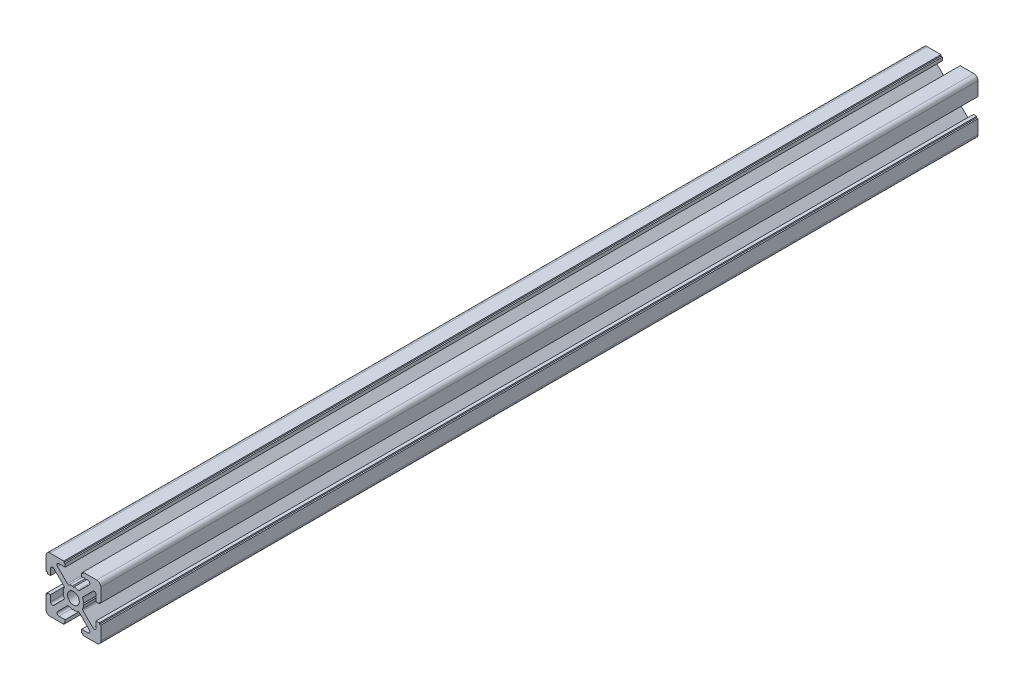
from build123d import *

# Parameters (mm, degrees)
SKETCH1_R           = 2.15
BOSS_EXTRUDE1_DEPTH = 320


# Read off the part's stored shape, not the designer's step: moBlkMgr[nhom 20x20x300]
with BuildPart() as part:
    # Sketch1 → Boss-Extrude1 (new body)
    with BuildSketch(Plane.XY.offset(330)):
        with BuildLine():
            Line((-3.499999948, -10), (-3.499999948, -9.5))
            Line((-3.499999948, -9.5), (-2.999999948, -9.5))
            Line((-2.999999948, -9.5), (-2.999999948, -8.299999966))
            Line((-2.999999948, -8.299999966), (-5.299390249, -8.299999966))
            ThreePointArc((-5.299390249, -8.299999966), (-5.946105921, -7.86787837), (-5.794364998, -7.105025221))
            Line((-5.794364998, -7.105025221), (-2.175465548, -3.48612574))
            ThreePointArc((-2.175465548, -3.48612574), (-1.907085057, -3.346986956), (-1.607569547, -3.387952169))
            ThreePointArc((-1.607569547, -3.387952169), (-0.96970891, -3.622452814), (-0.299999981, -3.73798071))
            Line((-0.299999981, -3.73798071), (1.9e-08, -3.449999972))
            Line((1.9e-08, -3.449999972), (0.300000019, -3.737980711))
            ThreePointArc((0.300000019, -3.737980711), (0.969708957, -3.622452812), (1.607569601, -3.387952162))
            ThreePointArc((1.607569601, -3.387952162), (1.90708511, -3.346986948), (2.175465602, -3.48612573))
            Line((2.175465602, -3.48612573), (5.794365084, -7.105025212))
            ThreePointArc((5.794365084, -7.105025212), (5.946106011, -7.867878366), (5.299390334, -8.299999966))
            Line((5.299390334, -8.299999966), (2.999999948, -8.299999966))
            Line((2.999999948, -8.299999966), (2.999999948, -9.5))
            Line((2.999999948, -9.5), (3.499999948, -9.5))
            Line((3.499999948, -9.5), (3.499999948, -10))
            Line((3.499999948, -10), (8.499999948, -10))
            ThreePointArc((8.499999948, -10), (9.56066012, -9.560660172), (9.999999948, -8.5))
            Line((9.999999948, -8.5), (9.999999948, -3.5))
            Line((9.999999948, -3.5), (9.499999948, -3.5))
            Line((9.499999948, -3.5), (9.499999948, -3))
            Line((9.499999948, -3), (8.299999978, -3))
            Line((8.299999978, -3), (8.299999978, -5.299390319))
            ThreePointArc((8.299999978, -5.299390319), (7.867878379, -5.946105992), (7.105025229, -5.794365063))
            Line((7.105025229, -5.794365063), (3.486125768, -2.17546557))
            ThreePointArc((3.486125768, -2.17546557), (3.346986986, -1.907085078), (3.387952202, -1.607569568))
            ThreePointArc((3.387952202, -1.607569568), (3.622452857, -0.969708918), (3.737980757, -0.299999973))
            Line((3.737980757, -0.299999973), (3.450000019, 2.8e-08))
            Line((3.450000019, 2.8e-08), (3.737980758, 0.300000028))
            ThreePointArc((3.737980758, 0.300000028), (3.622452857, 0.969708973), (3.387952202, 1.607569624))
            ThreePointArc((3.387952202, 1.607569624), (3.346986986, 1.907085133), (3.486125768, 2.175465626))
            Line((3.486125768, 2.175465626), (7.105025231, 5.794365121))
            ThreePointArc((7.105025231, 5.794365121), (7.86787838, 5.94610605), (8.299999978, 5.299390377))
            Line((8.299999978, 5.299390377), (8.299999978, 3))
            Line((8.299999978, 3), (9.499999948, 3))
            Line((9.499999948, 3), (9.499999948, 3.5))
            Line((9.499999948, 3.5), (9.999999948, 3.5))
            Line((9.999999948, 3.5), (9.999999948, 8.5))
            ThreePointArc((9.999999948, 8.5), (9.56066012, 9.560660172), (8.499999948, 10))
            Line((8.499999948, 10), (3.499999948, 10))
            Line((3.499999948, 10), (3.499999948, 9.5))
            Line((3.499999948, 9.5), (2.999999948, 9.5))
            Line((2.999999948, 9.5), (2.999999948, 8.300000022))
            Line((2.999999948, 8.300000022), (5.299390294, 8.300000022))
            ThreePointArc((5.299390294, 8.300000022), (5.946105963, 7.867878428), (5.794365041, 7.105025282))
            Line((5.794365041, 7.105025282), (2.175465586, 3.486125796))
            ThreePointArc((2.175465586, 3.486125796), (1.907085095, 3.346987012), (1.607569585, 3.387952225))
            ThreePointArc((1.607569585, 3.387952225), (0.969708948, 3.62245287), (0.300000018, 3.737980766))
            Line((0.300000018, 3.737980766), (1.9e-08, 3.450000028))
            Line((1.9e-08, 3.450000028), (-0.299999982, 3.737980766))
            ThreePointArc((-0.299999982, 3.737980766), (-0.969708911, 3.62245287), (-1.607569547, 3.387952225))
            ThreePointArc((-1.607569547, 3.387952225), (-1.907085057, 3.346987012), (-2.175465548, 3.486125796))
            Line((-2.175465548, 3.486125796), (-5.794364998, 7.105025277))
            ThreePointArc((-5.794364998, 7.105025277), (-5.946105921, 7.867878426), (-5.299390249, 8.300000022))
            Line((-5.299390249, 8.300000022), (-2.999999948, 8.300000022))
            Line((-2.999999948, 8.300000022), (-2.999999948, 9.5))
            Line((-2.999999948, 9.5), (-3.499999948, 9.5))
            Line((-3.499999948, 9.5), (-3.499999948, 10))
            Line((-3.499999948, 10), (-8.499999948, 10))
            ThreePointArc((-8.499999948, 10), (-9.56066012, 9.560660172), (-9.999999948, 8.5))
            Line((-9.999999948, 8.5), (-9.999999948, 3.5))
            Line((-9.999999948, 3.5), (-9.499999948, 3.5))
            Line((-9.499999948, 3.5), (-9.499999948, 3))
            Line((-9.499999948, 3), (-8.29999994, 3))
            Line((-8.29999994, 3), (-8.29999994, 5.299390329))
            ThreePointArc((-8.29999994, 5.299390329), (-7.867878345, 5.946105998), (-7.105025201, 5.794365073))
            Line((-7.105025201, 5.794365073), (-3.486125739, 2.175465611))
            ThreePointArc((-3.486125739, 2.175465611), (-3.346986957, 1.907085119), (-3.387952171, 1.607569609))
            ThreePointArc((-3.387952171, 1.607569609), (-3.622452821, 0.969708966), (-3.737980719, 0.300000029))
            Line((-3.737980719, 0.300000029), (-3.449999981, 2.8e-08))
            Line((-3.449999981, 2.8e-08), (-3.737980719, -0.299999971))
            ThreePointArc((-3.737980719, -0.299999971), (-3.622452819, -0.969708917), (-3.387952164, -1.607569568))
            ThreePointArc((-3.387952164, -1.607569568), (-3.346986948, -1.907085078), (-3.486125729, -2.17546557))
            Line((-3.486125729, -2.17546557), (-7.105025191, -5.794365063))
            ThreePointArc((-7.105025191, -5.794365063), (-7.867878341, -5.946105992), (-8.29999994, -5.299390319))
            Line((-8.29999994, -5.299390319), (-8.29999994, -3))
            Line((-8.29999994, -3), (-9.499999948, -3))
            Line((-9.499999948, -3), (-9.499999948, -3.5))
            Line((-9.499999948, -3.5), (-9.999999948, -3.5))
            Line((-9.999999948, -3.5), (-9.999999948, -8.5))
            ThreePointArc((-9.999999948, -8.5), (-9.56066012, -9.560660172), (-8.499999948, -10))
            Line((-8.499999948, -10), (-3.499999948, -10))
        make_face()
        with Locations(Location((1.9e-08, 2.8e-08, 0), (0, 0, 180))):
            Circle(SKETCH1_R, mode=Mode.SUBTRACT)
    extrude(amount=-BOSS_EXTRUDE1_DEPTH)


solid = part.part
